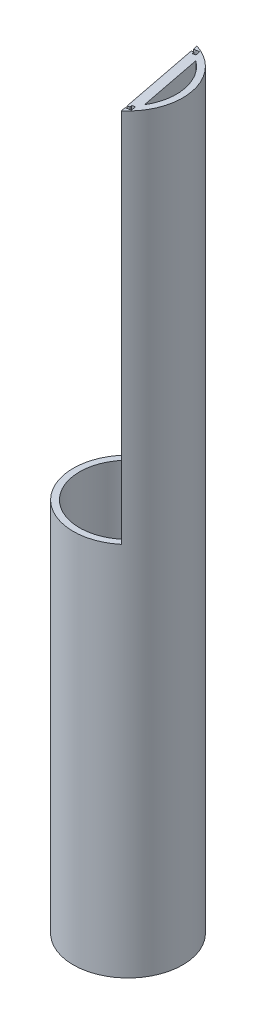
from build123d import *

# Parameters (mm, degrees)
SKETCH1_R           = 17.5
SKETCH1_R_2         = 15.5
BOSS_EXTRUDE1_DEPTH = 120
BOSS_EXTRUDE2_DEPTH = 120
SKETCH7_W           = 0.835577144
SKETCH7_H           = 120
CUT_EXTRUDE3_DEPTH  = 1
CUT_EXTRUDE4_DEPTH  = 120


with BuildPart() as part:
    # Sketch1 → Boss-Extrude1 (new body)
    with BuildSketch(Plane(origin=(0, 0, 0), x_dir=(1, 0, 0), z_dir=(0, 1, 0))):
        Circle(SKETCH1_R)
        Circle(SKETCH1_R_2, mode=Mode.SUBTRACT)
    extrude(amount=BOSS_EXTRUDE1_DEPTH)

    # Sketch2 → Boss-Extrude2 (add)
    with BuildSketch(Plane(origin=(0, 120, 0), x_dir=(1, 0, 0), z_dir=(0, 1, 0))):
        with BuildLine():
            Line((5.41803556, 16.640158974), (11.26826452, -13.38940681))
            ThreePointArc((11.26826452, -13.38940681), (17.177073612, 3.346362522), (5.41803556, 16.640158974))
        make_face()
        with BuildLine():
            Line((9.300567262, 12.399574533), (13.275015199, -8.001498076))
            ThreePointArc((13.275015199, -8.001498076), (15.213979485, 2.963921091), (9.300567262, 12.399574533))
        make_face(mode=Mode.SUBTRACT)
    extrude(amount=BOSS_EXTRUDE2_DEPTH)

    # Sketch7 → Cut-Extrude3 (cut)
    with BuildSketch(Plane(origin=(8.34315004, 0, -1.625376082), x_dir=(0.1912207155307578, 0, 0.9815470635440284), z_dir=(-0.9815470635440284, 0, 0.1912207155307578))):
        with Locations((-13.379269969, 180)):
            Rectangle(SKETCH7_W, SKETCH7_H)
        with Locations((13.379269969, 180)):
            Rectangle(SKETCH7_W, SKETCH7_H)
    extrude(amount=-CUT_EXTRUDE3_DEPTH, mode=Mode.SUBTRACT)

    # Sketch9 → Cut-Extrude4 (cut)
    with BuildSketch(Plane(origin=(0, 240, 0), x_dir=(1, 0, 0), z_dir=(0, 1, 0))):
        Polygon((6.4573473, 15.314433378), (6.758096524, 13.78364273), (7.739637111, 13.974862184), (7.438581348, 15.507213089), align=None)
        Polygon((12.715756275, -11.580832985), (11.733914113, -11.770491215), (11.438034608, -10.23875187), (12.419575195, -10.047532416), align=None)
    extrude(amount=-CUT_EXTRUDE4_DEPTH, mode=Mode.SUBTRACT)


solid = part.part
